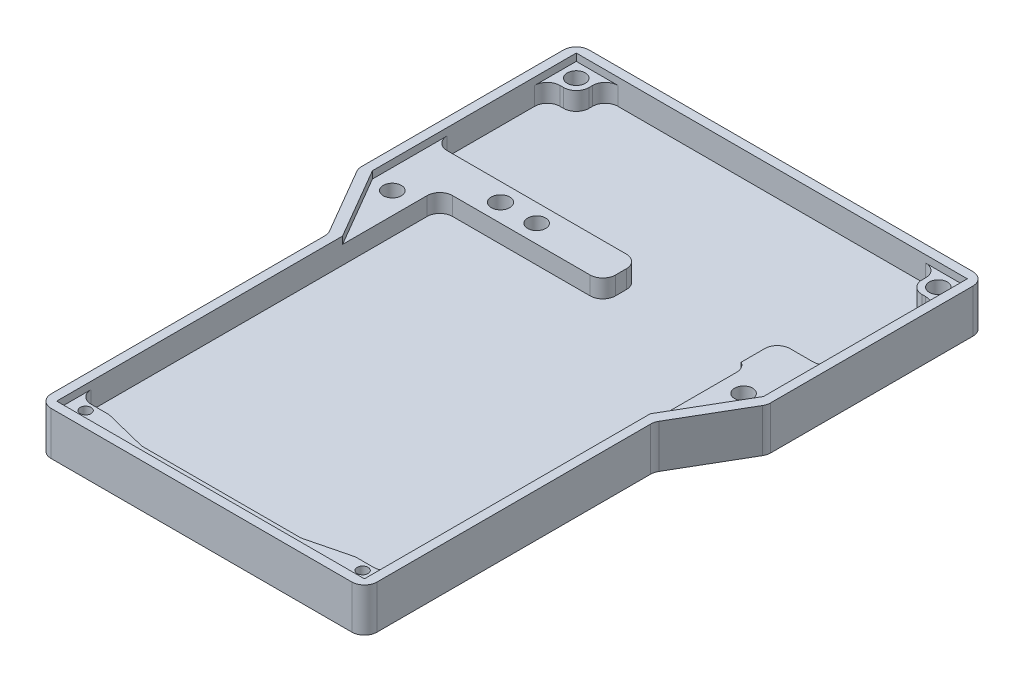
from build123d import *

# Parameters (mm, degrees)
BOSS_EXTRUDE1_DEPTH     = 5
BOSS_EXTRUDE2_DEPTH     = 7
SKETCH3_R               = 1.5
SKETCH3_W               = 8
SKETCH3_H               = 8
SKETCH3_R_2             = 2.5
BOSS_EXTRUDE3_DEPTH     = 5
SKETCH4_R               = 2.5
BOSS_EXTRUDE4_DEPTH     = 5
CUT_EXTRUDE1_DEPTH      = 123.769787834
CUT_EXTRUDE1_DEPTH_BACK = 123.769787834
SKETCH5_R               = 2.5
SKETCH5_R_2             = 2.55926668
SKETCH5_R_3             = 1.5
FILLET1_R               = 3.5


with BuildPart() as part:
    # Sketch1 → Boss-Extrude1 (new body)
    with BuildSketch(Plane(origin=(0, 0, 0), x_dir=(1, 0, 0), z_dir=(0, 1, 0))):
        Polygon((-57.597316241, 51.805869074), (-57.597316241, -8.444130926), (-46.097316241, -28.194130926), (-46.097316241, -108.194130926), (43.902683759, -108.194130926), (43.902683759, -28.194130926), (55.402683759, -8.444130926), (55.402683759, 51.805869074), align=None)
    extrude(amount=BOSS_EXTRUDE1_DEPTH)

    # Sketch2 → Boss-Extrude2 (add)
    with BuildSketch(Plane(origin=(0, 5, 0), x_dir=(1, 0, 0), z_dir=(0, 1, 0))):
        Polygon((-46.097316241, -28.194130926), (-46.097316241, -108.194130926), (43.902683759, -108.194130926), (43.902683759, -28.194130926), (41.402683759, -28.194130926), (41.402683759, -105.694130926), (-43.597316241, -105.694130926), (-43.597316241, -28.194130926), align=None)
        Polygon((52.902683759, -6.988434723), (55.402683759, -8.444130926), (43.902683759, -28.194130926), (41.402683759, -26.738434723), align=None)
        Polygon((41.402683759, -28.194130926), (43.902683759, -28.194130926), (41.402683759, -26.738434723), align=None)
        Polygon((52.902683759, -6.988434723), (55.402683759, -8.444130926), (55.402683759, -6.988434723), align=None)
        Polygon((-57.597316241, 51.805869074), (-57.597316241, -6.988434723), (-55.097316241, -6.988434723), (-55.097316241, 49.305869074), (52.902683759, 49.305869074), (52.902683759, -6.988434723), (55.402683759, -6.988434723), (55.402683759, 51.805869074), align=None)
        Polygon((-43.597316241, -26.738434723), (-46.097316241, -28.194130926), (-43.597316241, -28.194130926), align=None)
        Polygon((-43.597316241, -26.738434723), (-46.097316241, -28.194130926), (-57.597316241, -8.444130926), (-55.097316241, -6.988434723), align=None)
        Polygon((-57.597316241, -6.988434723), (-57.597316241, -8.444130926), (-55.097316241, -6.988434723), align=None)
    extrude(amount=BOSS_EXTRUDE2_DEPTH)

    # Sketch3 → Boss-Extrude3 (add)
    # profile 1 of 3: a face of its own
    with BuildSketch(Plane(origin=(0, 5, 0), x_dir=(1, 0, 0), z_dir=(0, 1, 0))):
        Polygon((-43.597316241, -99.694130926), (-43.597316241, -105.694130926), (41.402683759, -105.694130926), (41.402683759, -99.694130926), (32.902683759, -99.694130926), (20.902683759, -102.694130926), (-23.097316241, -102.694130926), (-35.097316241, -99.694130926), align=None)
        with Locations(Location((-39.347316241, -101.944130926, 0), (0, 0, 270))):
            Circle(SKETCH3_R, mode=Mode.SUBTRACT)
        with Locations(Location((37.152683759, -101.944130926, 0), (0, 0, 270))):
            Circle(SKETCH3_R, mode=Mode.SUBTRACT)
    # profile 2 of 3: a face of its own
    with BuildSketch(Plane(origin=(0, 5, 0), x_dir=(1, 0, 0), z_dir=(0, 1, 0))):
        with Locations((-51.097316241, 45.305869074)):
            Rectangle(SKETCH3_W, SKETCH3_H)
        with Locations(Location((-51.097316241, 45.305869074, 0), (0, 0, 270))):
            Circle(SKETCH3_R_2, mode=Mode.SUBTRACT)
    # profile 3 of 3: a face of its own
    with BuildSketch(Plane(origin=(0, 5, 0), x_dir=(1, 0, 0), z_dir=(0, 1, 0))):
        with Locations((48.902683759, 45.305869074)):
            Rectangle(SKETCH3_W, SKETCH3_H)
        with Locations(Location((48.902683759, 45.305869074, 0), (0, 0, 270))):
            Circle(SKETCH3_R_2, mode=Mode.SUBTRACT)
    extrude(amount=BOSS_EXTRUDE3_DEPTH)

    # Sketch4 → Boss-Extrude4 (add)
    # profile 1 of 2: a face of its own
    with BuildSketch(Plane(origin=(0, 5, 0), x_dir=(1, 0, 0), z_dir=(0, 1, 0))):
        Polygon((1.402683759, 10.130869074), (-55.097316241, 10.130869074), (-55.097316241, -6.988434723), (-43.597316241, -26.738434723), (-43.597316241, 0.130869074), (1.402683759, 0.130869074), align=None)
        with Locations(Location((-31.847316241, 5.130869074, 0), (0, 0, 90))):
            Circle(SKETCH4_R, mode=Mode.SUBTRACT)
        with Locations(Location((-21.847316241, 5.130869074, 0), (0, 0, 90))):
            Circle(SKETCH4_R, mode=Mode.SUBTRACT)
    # profile 2 of 2: a face of its own
    with BuildSketch(Plane(origin=(0, 5, 0), x_dir=(1, 0, 0), z_dir=(0, 1, 0))):
        Polygon((39.6145491, 10.130869074), (39.6145491, 0.130869074), (41.402683759, 0.130869074), (41.402683759, -26.738434723), (52.902683759, -6.988434723), (52.902683759, 10.130869074), align=None)
    extrude(amount=BOSS_EXTRUDE4_DEPTH)

    # Sketch5 → Cut-Extrude1 (cut, two sides: drawn at the far end of the back side and taken through both)
    with BuildSketch(Plane(origin=(0, 5, 0), x_dir=(1, 0, 0), z_dir=(0, 1, 0)).offset(-CUT_EXTRUDE1_DEPTH_BACK)):
        with Locations(Location((-21.847316241, 5.130869074, 0), (0, 0, 90))):
            Circle(SKETCH5_R)
        with Locations(Location((-31.847316241, 5.130869074, 0), (0, 0, 270))):
            Circle(SKETCH5_R_2)
        with Locations(Location((-39.347316241, -101.944130926, 0), (0, 0, 270))):
            Circle(SKETCH5_R_3)
        with Locations(Location((37.152683759, -101.944130926, 0), (0, 0, 270))):
            Circle(SKETCH5_R_3)
        with Locations(Location((-51.097316241, 45.305869074, 0), (0, 0, 270))):
            Circle(SKETCH5_R)
        with Locations(Location((48.902683759, 45.305869074, 0), (0, 0, 270))):
            Circle(SKETCH5_R)
        with Locations(Location((-49.597316241, -6.988434723, 0), (0, 0, 270))):
            Circle(SKETCH5_R)
        with Locations(Location((47.402683759, -6.988434723, 0), (0, 0, 270))):
            Circle(SKETCH5_R)
    extrude(amount=CUT_EXTRUDE1_DEPTH + CUT_EXTRUDE1_DEPTH_BACK, mode=Mode.SUBTRACT)

    # Fillet1
    # the kernel refuses this fillet: 3.5 mm, written as the material it adds along each edge
    with BuildSketch(Plane(origin=(41.402683759, 5, 99.694130926), x_dir=(0, 0, -1), z_dir=(0, 1, 0)), Plane(origin=(-55.097316241, 5, -41.305869074), x_dir=(0, 0, 1), z_dir=(0, 1, 0)), Plane(origin=(44.902683759, 5, -49.305869074), x_dir=(-1, 0, 0), z_dir=(0, 1, 0)), Plane(origin=(52.902683759, 5, -10.130869074), x_dir=(0, 0, -1), z_dir=(0, 1, 0)), Plane(origin=(-43.597316241, 5, -0.130869074), x_dir=(0, 0, 1), z_dir=(0, 1, 0))) as fillet1_piece_1:
        with BuildLine():
            CenterArc((FILLET1_R, FILLET1_R), FILLET1_R, 180, 90)
            Line((0, FILLET1_R), (0, 0))
            Line((0, 0), (FILLET1_R, 0))
        make_face()
    extrude(amount=5)
    with BuildSketch(Plane(origin=(20.902683759, 3.922825776, 102.694130926), x_dir=(-1, 0, 0), z_dir=(0, 1, 0)), Plane(origin=(-23.097316241, 3.922825776, 102.694130926), x_dir=(-0.9701425001453338, 0, -0.2425356250363252), z_dir=(0, 1, 0))) as fillet1_piece_2:
        with BuildLine():
            CenterArc((FILLET1_R * 0.123105625618, -FILLET1_R), FILLET1_R, 90, 14.036243468)
            Line((-FILLET1_R * 0.119429999419, -FILLET1_R * 0.0298574998547), (0, 0))
            Line((0, 0), (FILLET1_R * 0.123105625618, 0))
        make_face()
    extrude(amount=6.077174224)
    with BuildSketch(Plane(origin=(-43.597316241, 5, 99.694130926), x_dir=(0, 0, -1), z_dir=(0, 1, 0)), Plane(origin=(-47.097316241, 5, -49.305869074), x_dir=(1, 0, 0), z_dir=(0, 1, 0)), Plane(origin=(52.902683759, 5, -41.305869074), x_dir=(0, 0, 1), z_dir=(0, 1, 0)), Plane(origin=(-55.097316241, 5, -10.130869074), x_dir=(0, 0, -1), z_dir=(0, 1, 0))) as fillet1_piece_3:
        with BuildLine():
            CenterArc((FILLET1_R, -FILLET1_R), FILLET1_R, 90, 90)
            Line((0, -FILLET1_R), (0, 0))
            Line((0, 0), (FILLET1_R, 0))
        make_face()
    extrude(amount=5)
    with BuildSketch(Plane(origin=(43.902683759, 12, 28.194130926), x_dir=(0.5031907286678252, 0, -0.864175381842565), z_dir=(0, -1, 0)), Plane(origin=(-46.097316241, 0, 28.194130926), x_dir=(-0.5031907286678269, 0, -0.8641753818425641), z_dir=(0, 1, 0))) as fillet1_piece_4:
        with BuildLine():
            CenterArc((FILLET1_R * 0.269926710528, FILLET1_R), FILLET1_R, 239.788677614, 30.211322386)
            Line((-FILLET1_R * 0.23326401814, FILLET1_R * 0.135824618157), (0, 0))
            Line((0, 0), (FILLET1_R * 0.269926710528, 0))
        make_face()
    extrude(amount=12)
    with BuildSketch(Plane(origin=(41.402683759, 5, -0.130869074), x_dir=(0, 0, 1), z_dir=(0, 1, 0))) as fillet1_piece_5:
        with BuildLine():
            CenterArc((3.052788407, -3.5), FILLET1_R, 90, 60.718267745)
            Line((0, -1.788134659), (0, 0))
            Line((0, 0), (3.052788407, 0))
        make_face()
    extrude(amount=5)
    # the kernel refuses this fillet: 3.5 mm, written as the material it takes off along each edge
    with BuildSketch(Plane(origin=(32.902683759, 5, 99.694130926), x_dir=(1, 0, 0), z_dir=(0, 1, 0)), Plane(origin=(-35.097316241, 5, 99.694130926), x_dir=(0.9701425001453338, 0, 0.2425356250363252), z_dir=(0, 1, 0))) as fillet1_2_piece_1:
        with BuildLine():
            CenterArc((FILLET1_R * 0.123105625618, -FILLET1_R), FILLET1_R, 90, 14.036243468)
            Line((-FILLET1_R * 0.119429999419, -FILLET1_R * 0.0298574998547), (0, 0))
            Line((0, 0), (FILLET1_R * 0.123105625618, 0))
        make_face()
    extrude(amount=6.077174224, mode=Mode.SUBTRACT)
    with BuildSketch(Plane(origin=(-47.097316241, 5, -41.305869074), x_dir=(-1, 0, 0), z_dir=(0, 1, 0)), Plane(origin=(44.902683759, 5, -41.305869074), x_dir=(0, 0, -1), z_dir=(0, 1, 0)), Plane(origin=(39.6145491, 5, -10.130869074), x_dir=(1, 0, 0), z_dir=(0, 1, 0)), Plane(origin=(1.402683759, 5, -10.130869074), x_dir=(0, 0, 1), z_dir=(0, 1, 0))) as fillet1_2_piece_2:
        with BuildLine():
            CenterArc((FILLET1_R, -FILLET1_R), FILLET1_R, 90, 90)
            Line((0, -FILLET1_R), (0, 0))
            Line((0, 0), (FILLET1_R, 0))
        make_face()
    extrude(amount=13.75, mode=Mode.SUBTRACT)
    with BuildSketch(Plane(origin=(55.402683759, 14.361858717, 8.444130926), x_dir=(0, 0, -1), z_dir=(0, -1, 0)), Plane(origin=(-57.597316241, -2.361858717, 8.444130926), x_dir=(0, 0, -1), z_dir=(0, 1, 0))) as fillet1_2_piece_3:
        with BuildLine():
            CenterArc((FILLET1_R * 0.269926710528, -FILLET1_R), FILLET1_R, 90, 30.211322386)
            Line((-FILLET1_R * 0.23326401814, -FILLET1_R * 0.135824618157), (0, 0))
            Line((0, 0), (FILLET1_R * 0.269926710528, 0))
        make_face()
    extrude(amount=16.723717434, mode=Mode.SUBTRACT)
    with BuildSketch(Plane(origin=(43.902683759, 20.75, 108.194130926), x_dir=(-1, 0, 0), z_dir=(0, -1, 0))) as fillet1_2_piece_4:
        with BuildLine():
            CenterArc((FILLET1_R, FILLET1_R), FILLET1_R, 180, 90)
            Line((0, FILLET1_R), (0, 0))
            Line((0, 0), (FILLET1_R, 0))
        make_face()
    extrude(amount=29.5, mode=Mode.SUBTRACT)
    with BuildSketch(Plane(origin=(-46.097316241, -8.75, 108.194130926), x_dir=(0, 0, -1), z_dir=(0, 1, 0)), Plane(origin=(-57.597316241, -8.75, -51.805869074), x_dir=(1, 0, 0), z_dir=(0, 1, 0)), Plane(origin=(55.402683759, -8.75, -51.805869074), x_dir=(0, 0, 1), z_dir=(0, 1, 0))) as fillet1_2_piece_5:
        with BuildLine():
            CenterArc((FILLET1_R, -FILLET1_R), FILLET1_R, 90, 90)
            Line((0, -FILLET1_R), (0, 0))
            Line((0, 0), (FILLET1_R, 0))
        make_face()
    extrude(amount=29.5, mode=Mode.SUBTRACT)
    with BuildSketch(Plane(origin=(1.402683759, 5, -0.130869074), x_dir=(0, 0, -1), z_dir=(0, 1, 0))) as fillet1_2_piece_6:
        with BuildLine():
            CenterArc((FILLET1_R, FILLET1_R), FILLET1_R, 180, 90)
            Line((0, FILLET1_R), (0, 0))
            Line((0, 0), (FILLET1_R, 0))
        make_face()
    extrude(amount=13.75, mode=Mode.SUBTRACT)


solid = part.part
